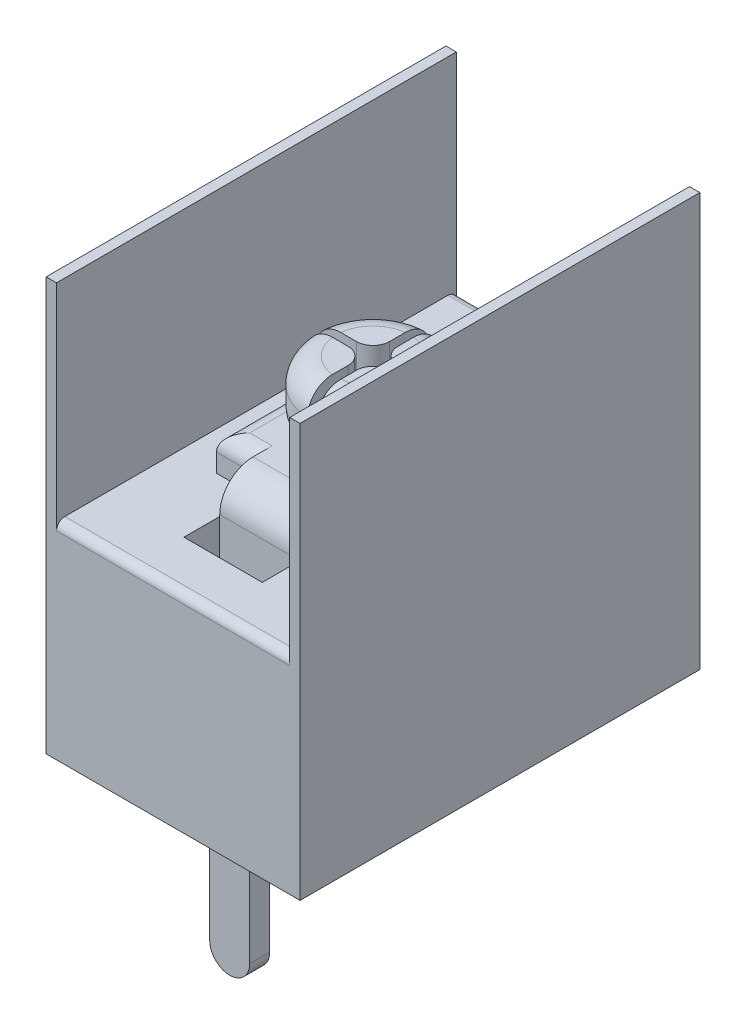
from build123d import *

# Parameters (mm, degrees)
SKETCH_1_W          = 7.62
SKETCH_1_H          = 12
EXTRUDE_1_DEPTH     = 12.4
SKETCH_2_W          = 1.2
SKETCH_2_H          = 0.6
EXTRUDE_2_DEPTH     = 4.7
FILLET_1_R          = 0.6
SKETCH_3_W          = 7
SKETCH_3_H          = 12
CUT_EXTRUDE_1_DEPTH = 6.2
CUT_EXTRUDE_3_DEPTH = 3.1
SKETCH_5_R          = 1.5
EXTRUDE_4_DEPTH     = 4.15
SKETCH_6_R          = 1.5
EXTRUDE_5_DEPTH     = 4.15
FILLET_2_R          = 1
FILLET_3_R          = 0.5
SKETCH_7_R          = 1.85
EXTRUDE_6_DEPTH     = 2
FILLET_4_R          = 0.75
SKETCH_8_W          = 0.25
SKETCH_8_H          = 5
SKETCH_8_W_2        = 5
SKETCH_8_H_2        = 0.25
CUT_EXTRUDE_4_DEPTH = 1
FILLET_5_R          = 0.5
FILLET_6_R          = 0.25
SKETCH_9_R          = 0.75
CUT_EXTRUDE_5_DEPTH = 0.25
SKETCH_10_W         = 1.2
SKETCH_10_H         = 0.6
EXTRUDE_7_DEPTH     = 0.25


with BuildPart() as part:
    # 草图1 → 凸台-拉伸1 (new body)
    with BuildSketch(Plane(origin=(0, 0, 0), x_dir=(1, 0, 0), z_dir=(0, 1, 0))):
        Rectangle(SKETCH_1_W, SKETCH_1_H)
    extrude(amount=EXTRUDE_1_DEPTH)

    # 草图3 → 切除-拉伸1 (cut)
    with BuildSketch(Plane(origin=(0, 12.4, 0), x_dir=(1, 0, 0), z_dir=(0, 1, 0))):
        Rectangle(SKETCH_3_W, SKETCH_3_H)
    extrude(amount=-CUT_EXTRUDE_1_DEPTH, mode=Mode.SUBTRACT)

    # 草图4 → 切除-拉伸3 (cut)
    with BuildSketch(Plane(origin=(0, 6.2, 0), x_dir=(1, 0, 0), z_dir=(0, 1, 0))):
        Polygon((1.175, 2.35), (2.35, 2.35), (2.35, -2.35), (1.175, -2.35), (1.175, -4.5), (-1.175, -4.5), (-1.175, -2.35), (-2.35, -2.35), (-2.35, 2.35), (-1.175, 2.35), (-1.175, 4.5), (1.175, 4.5), align=None)
    extrude(amount=-CUT_EXTRUDE_3_DEPTH, mode=Mode.SUBTRACT)

    # 圆角6
    fillet_6_edges = [part.edges().sort_by_distance(p)[0] for p in [
        (0, 6.2, 6),
        (0, 6.2, -6),
    ]]
    fillet(fillet_6_edges, radius=FILLET_6_R)

    # 草图9 → 切除-拉伸5 (cut)
    with BuildSketch(Plane.XZ):
        with Locations(Location((0, 4, 0), (0, 0, 270))):
            Circle(SKETCH_9_R)
    extrude(amount=-CUT_EXTRUDE_5_DEPTH, mode=Mode.SUBTRACT)


with BuildPart() as body_2:
    # 草图2 → 凸台-拉伸2 (new body)
    with BuildSketch(Plane(origin=(0, 0, 0), x_dir=(-1, 0, 0), z_dir=(0, -1, 0))):
        with Locations((0, -4)):
            Rectangle(SKETCH_2_W, SKETCH_2_H)
    extrude(amount=EXTRUDE_2_DEPTH)

    # 圆角1
    fillet_1_edges = [body_2.edges().sort_by_distance(p)[0] for p in [
        (0.6, -4.7, 4),
        (-0.6, -4.7, 4),
    ]]
    fillet(fillet_1_edges, radius=FILLET_1_R - 0.0001)  # a hair under: the kernel refuses the full size

    # 草图10 → 凸台-拉伸7 (add)
    with BuildSketch(Plane(origin=(0, 0, 0), x_dir=(1, 0, 0), z_dir=(0, 1, 0))):
        with Locations((0, -4)):
            Rectangle(SKETCH_10_W, SKETCH_10_H)
    extrude(amount=EXTRUDE_7_DEPTH)


with BuildPart() as body_3:
    # 草图5 → 凸台-拉伸4 (new body)
    with BuildSketch(Plane(origin=(0, 3.1, 0), x_dir=(1, 0, 0), z_dir=(0, 1, 0))):
        Polygon((-2.35, 2.35), (-2.35, -2.35), (-1.175, -2.35), (-1.175, -3.425), (1.175, -3.425), (1.175, -2.35), (2.35, -2.35), (2.35, 2.35), (1.175, 2.35), (1.175, 3.425), (-1.175, 3.425), (-1.175, 2.35), align=None)
        with Locations(Location((0, 0, 0), (0, 0, 90))):
            Circle(SKETCH_5_R, mode=Mode.SUBTRACT)
    extrude(amount=EXTRUDE_4_DEPTH)

    # 圆角2
    fillet_2_edges = [body_3.edges().sort_by_distance(p)[0] for p in [
        (0, 7.25, 3.425),
        (0, 7.25, -3.425),
    ]]
    fillet(fillet_2_edges, radius=FILLET_2_R)

    # 圆角3
    fillet_3_edges = [body_3.edges().sort_by_distance(p)[0] for p in [
        (-1.7625, 7.25, 2.35),
        (1.7625, 7.25, 2.35),
        (2.35, 7.25, 0),
        (1.7625, 7.25, -2.35),
        (-1.7625, 7.25, -2.35),
        (-2.35, 7.25, 0),
    ]]
    fillet(fillet_3_edges, radius=FILLET_3_R)


with BuildPart() as body_4:
    # 草图6 → 凸台-拉伸5 (new body)
    with BuildSketch(Plane(origin=(0, 3.1, 0), x_dir=(1, 0, 0), z_dir=(0, 1, 0))):
        with Locations(Location((0, 0, 0), (0, 0, 90))):
            Circle(SKETCH_6_R)
    extrude(amount=EXTRUDE_5_DEPTH)


with BuildPart() as body_5:
    # 草图7 → 凸台-拉伸6 (new body)
    with BuildSketch(Plane(origin=(0, 7.25, 0), x_dir=(1, 0, 0), z_dir=(0, 1, 0))):
        with Locations(Location((0, 0, 0), (0, 0, 270))):
            Circle(SKETCH_7_R)
    extrude(amount=EXTRUDE_6_DEPTH)

    # 圆角4
    fillet_4_edges = [body_5.edges().sort_by_distance(p)[0] for p in [
        (0, 7.25, -1.85),
        (0, 9.25, -1.85),
    ]]
    fillet(fillet_4_edges, radius=FILLET_4_R)

    # 草图8 → 切除-拉伸4 (cut)
    with BuildSketch(Plane(origin=(0, 9.25, 0), x_dir=(1, 0, 0), z_dir=(0, 1, 0))):
        Rectangle(SKETCH_8_W, SKETCH_8_H)
        Rectangle(SKETCH_8_W_2, SKETCH_8_H_2)
    extrude(amount=-CUT_EXTRUDE_4_DEPTH, mode=Mode.SUBTRACT)

    # 圆角5
    fillet_5_edges = [body_5.edges().sort_by_distance(p)[0] for p in [
        (-0.125, 8.75, 0.125),
        (0.125, 8.75, -0.125),
        (0.125, 8.75, 0.125),
        (-0.125, 8.75, -0.125),
    ]]
    fillet(fillet_5_edges, radius=FILLET_5_R)


with BuildPart() as body_4_1:
    add(body_4.part)

    # Combine 1: union body 5
    add(body_5.part)


solid = Compound([part.part, body_2.part, body_3.part, body_4_1.part])
